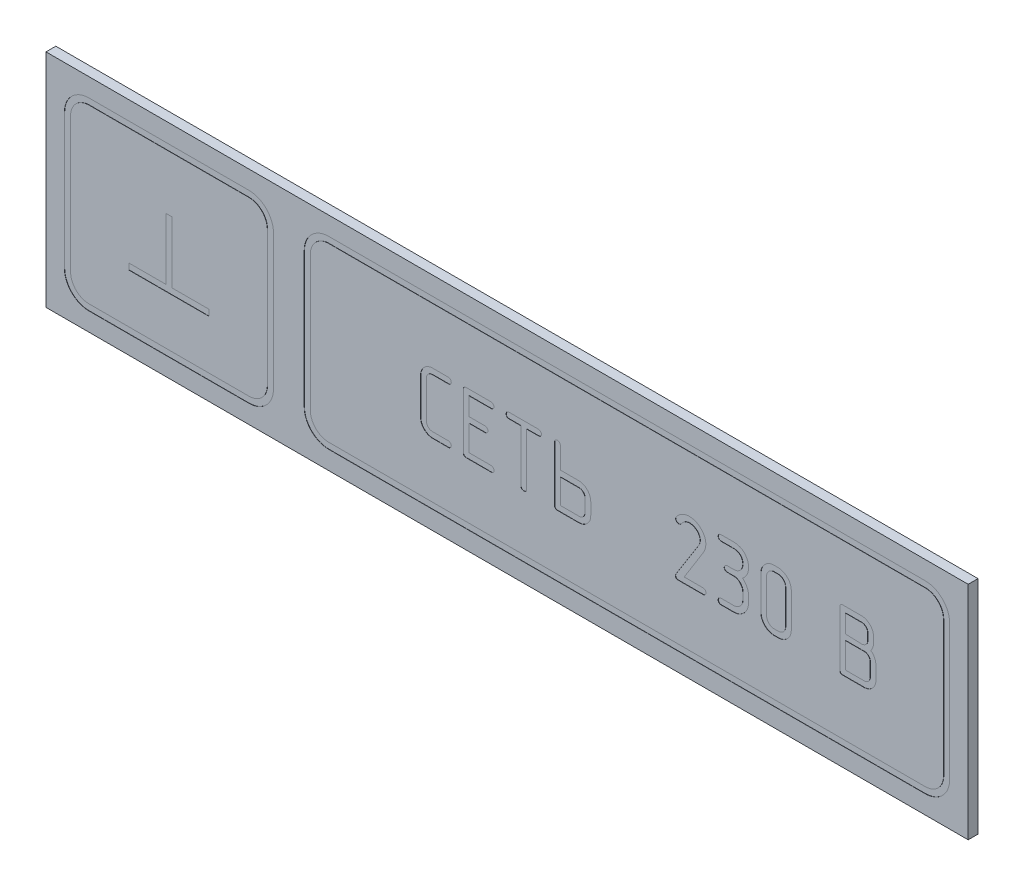
from build123d import *

# Parameters (mm, degrees)
SKETCH_1_W                 = 75
SKETCH_1_H                 = 18
EXTRUDE_1_DEPTH            = 0.8
CUT_EXTRUDE_1_DEPTH        = 0.02
CUT_EXTRUDE_1_2_DEPTH      = 0.02
CUT_EXTRUDE_1_2_DEPTH_BACK = 0.02
SKETCH_3_W                 = 0.5
SKETCH_3_H                 = 5
CUT_EXTRUDE_2_DEPTH        = 0.02
CUT_EXTRUDE_2_DEPTH_BACK   = 0.02
SKETCH_4_W                 = 6.5
SKETCH_4_H                 = 0.5
CUT_EXTRUDE_3_DEPTH        = 0.02
CUT_EXTRUDE_3_DEPTH_BACK   = 0.02
CUT_EXTRUDE_4_DEPTH        = 0.02
CUT_EXTRUDE_4_DEPTH_BACK   = 0.02


with BuildPart() as part:
    # Эскиз1 → Вытянуть1 (new body)
    with BuildSketch(Plane.XY):
        with Locations((37.5, 9)):
            Rectangle(SKETCH_1_W, SKETCH_1_H)
    extrude(amount=EXTRUDE_1_DEPTH)

    # Эскиз2 → Cut-Extrude 1 (cut)
    # profile 1 of 8: a face of its own
    with BuildSketch(Plane.XY.offset(0.8)):
        with BuildLine():
            Line((32.711430426, 6.5), (31.465384009, 6.5))
            add(Edge.make_bspline(
                [(31.465384009, 6.5), (31.431912507, 6.500692398), (31.366073578, 6.502054355), (31.269135798, 6.516147373), (31.176104046, 6.539026677), (31.086487447, 6.571099898), (30.999214891, 6.610006247), (30.916804958, 6.66126394), (30.837218441, 6.71958233), (30.762182539, 6.786197437), (30.694019841, 6.859929755), (30.633066214, 6.937710954), (30.582651343, 7.020395092), (30.540431871, 7.106184125), (30.507819861, 7.196573266), (30.485489392, 7.290884807), (30.469610078, 7.388654905), (30.468489421, 7.455271142), (30.467920197, 7.489108095)],
                knots=[0, 0, 0, 0, 1.028286897, 2.022655204, 3.003804875, 3.968473356, 4.945411562, 5.93469887, 6.945007337, 7.975963957, 9.013399247, 10.028062878, 11.008219808, 11.984630304, 12.962974347, 13.954516674, 14.96102025, 16, 16, 16, 16], degree=3))
            Line((30.467920197, 7.489108095), (30.467920197, 10.457476843))
            add(Edge.make_bspline(
                [(30.467920197, 10.457476843), (30.468608989, 10.491296864), (30.469964025, 10.557829724), (30.484112278, 10.655793657), (30.506806414, 10.750026222), (30.539545402, 10.840157986), (30.580522135, 10.92614383), (30.629595652, 11.008725853), (30.690124145, 11.08571364), (30.757254904, 11.159304164), (30.830738751, 11.227240256), (30.910229977, 11.285561399), (30.993344013, 11.334758989), (31.079606898, 11.376551217), (31.170705417, 11.407165236), (31.265263444, 11.4306427), (31.364007094, 11.444486985), (31.431221697, 11.445877963), (31.465384009, 11.446584938)],
                knots=[0, 0, 0, 0, 1.037183757, 2.040412751, 3.030241086, 4.006893952, 4.976980221, 5.949886173, 6.947810811, 7.976208698, 9.004606584, 10.01316862, 10.99524074, 11.965327009, 12.948502614, 13.93833095, 14.952141686, 16, 16, 16, 16], degree=3))
            Line((31.465384009, 11.446584938), (32.711430426, 11.446584938))
            add(Edge.make_bspline(
                [(32.711430426, 11.446584938), (32.728236112, 11.445906647), (32.761049842, 11.444582258), (32.808190363, 11.430479344), (32.85063334, 11.406583863), (32.888980052, 11.375643018), (32.920420665, 11.33890977), (32.944674489, 11.299360852), (32.958873659, 11.256746607), (32.960328798, 11.227347282), (32.961057495, 11.212624839)],
                knots=[0, 0, 0, 0, 1.064052253, 2.077601868, 3.0860831, 4.13837496, 5.187880517, 6.138828305, 7.06797199, 8, 8, 8, 8], degree=3))
            add(Edge.make_bspline(
                [(32.961057495, 11.212624839), (32.957710349, 11.185576062), (32.950561645, 11.127806356), (32.908493276, 11.064068569), (32.863109533, 11.019749207), (32.818623115, 10.994831447), (32.765769924, 10.981780717), (32.728211501, 10.979744432), (32.708297032, 10.978664741)],
                knots=[0, 0, 0, 0, 1.266254501, 2.704416213, 3.467614585, 4.236046379, 5.064705186, 6, 6, 6, 6], degree=3))
            Line((32.708297032, 10.978664741), (31.442405785, 10.978664741))
            add(Edge.make_bspline(
                [(31.442405785, 10.978664741), (31.408124572, 10.9767522), (31.340969725, 10.973005646), (31.24432295, 10.946654529), (31.156095082, 10.900695466), (31.106349514, 10.857544089), (31.08102099, 10.835573073)],
                knots=[0, 0, 0, 0, 1.032059628, 2.021743112, 2.992747939, 4, 4, 4, 4], degree=3))
            add(Edge.make_bspline(
                [(31.08102099, 10.835573073), (31.058649956, 10.8106462), (31.014364988, 10.761301776), (30.968174097, 10.673004457), (30.941568469, 10.577039088), (30.937769851, 10.510910707), (30.935840394, 10.477321673)],
                knots=[0, 0, 0, 0, 1.010358544, 2.000072701, 2.984163436, 4, 4, 4, 4], degree=3))
            Line((30.935840394, 10.477321673), (30.935840394, 7.469263265))
            add(Edge.make_bspline(
                [(30.935840394, 7.469263265), (30.937619289, 7.435285028), (30.941108852, 7.368631758), (30.969501979, 7.273234658), (31.014426689, 7.18481654), (31.058564491, 7.135899799), (31.08102099, 7.111011864)],
                knots=[0, 0, 0, 0, 1.026550069, 2.013727771, 2.989421339, 4, 4, 4, 4], degree=3))
            add(Edge.make_bspline(
                [(31.08102099, 7.111011864), (31.106546591, 7.0902839), (31.157077608, 7.049250385), (31.214498254, 7.018599617), (31.242913023, 7.003431997)],
                knots=[0, 0, 0, 0, 1.010294363, 2, 2, 2, 2], degree=3))
            add(Edge.make_bspline(
                [(31.242913023, 7.003431997), (31.277490783, 6.993357837), (31.342743748, 6.974346517), (31.410536592, 6.969975158), (31.442405785, 6.967920197)],
                knots=[0, 0, 0, 0, 1.059806561, 2, 2, 2, 2], degree=3))
            Line((31.442405785, 6.967920197), (32.708297032, 6.967920197))
            add(Edge.make_bspline(
                [(32.708297032, 6.967920197), (32.725099979, 6.967215952), (32.758243218, 6.965826854), (32.806027173, 6.951787857), (32.849432241, 6.928244075), (32.887885736, 6.896933272), (32.919486601, 6.860289213), (32.943336648, 6.820479722), (32.959177226, 6.778299232), (32.960431674, 6.74871775), (32.961057495, 6.733960098)],
                knots=[0, 0, 0, 0, 1.057748023, 2.086371758, 3.108174774, 4.154232081, 5.197519594, 6.142833266, 7.073494011, 8, 8, 8, 8], degree=3))
            add(Edge.make_bspline(
                [(32.961057495, 6.733960098), (32.957667706, 6.7069257), (32.950450626, 6.649367712), (32.909356455, 6.585759924), (32.865129234, 6.540784748), (32.820667275, 6.516216561), (32.768211496, 6.503190536), (32.730998743, 6.501099546), (32.711430426, 6.5)],
                knots=[0, 0, 0, 0, 1.274021799, 2.712475087, 3.468462899, 4.24160831, 5.075350171, 6, 6, 6, 6], degree=3))
        make_face()
    # profile 2 of 8: a face of its own
    with BuildSketch(Plane.XY.offset(0.8)):
        with BuildLine():
            Line((34.411818998, 9.508058408), (35.692332751, 9.508058408))
            add(Edge.make_bspline(
                [(35.692332751, 9.508058408), (35.709488684, 9.507384113), (35.742989971, 9.506067383), (35.791091929, 9.491912313), (35.834571553, 9.468434262), (35.872916627, 9.436725712), (35.905677323, 9.400786893), (35.929415327, 9.360577439), (35.945313233, 9.318447448), (35.946560104, 9.288859291), (35.947182144, 9.27409831)],
                knots=[0, 0, 0, 0, 1.074751076, 2.09872259, 3.115904232, 4.15723047, 5.210194549, 6.151232792, 7.077684378, 8, 8, 8, 8], degree=3))
            add(Edge.make_bspline(
                [(35.947182144, 9.27409831), (35.946247595, 9.260459507), (35.944347103, 9.23272373), (35.932807206, 9.191665272), (35.911722217, 9.152225082), (35.88470522, 9.114203049), (35.848604782, 9.080976147), (35.803687653, 9.056293589), (35.750120921, 9.043352744), (35.712239866, 9.041245567), (35.692332751, 9.040138211)],
                knots=[0, 0, 0, 0, 0.847894216, 1.724271911, 2.623827054, 3.614447941, 4.609544371, 5.645179484, 6.762503223, 8, 8, 8, 8], degree=3))
            Line((35.692332751, 9.040138211), (34.411818998, 9.040138211))
            Line((34.411818998, 9.040138211), (34.411818998, 6.967920197))
            Line((34.411818998, 6.967920197), (36.187409031, 6.967920197))
            add(Edge.make_bspline(
                [(36.187409031, 6.967920197), (36.204211978, 6.967215952), (36.237355217, 6.965826854), (36.285139172, 6.951787857), (36.32854424, 6.928244075), (36.366997735, 6.896933272), (36.3985986, 6.860289213), (36.422448647, 6.820479722), (36.438289225, 6.778299232), (36.439543673, 6.74871775), (36.440169494, 6.733960098)],
                knots=[0, 0, 0, 0, 1.057748023, 2.086371758, 3.108174774, 4.154232081, 5.197519594, 6.142833266, 7.073494011, 8, 8, 8, 8], degree=3))
            add(Edge.make_bspline(
                [(36.440169494, 6.733960098), (36.436906743, 6.706205379), (36.430086342, 6.648187368), (36.38871287, 6.584335932), (36.343876302, 6.540831002), (36.299823699, 6.5161683), (36.247310578, 6.503204568), (36.21010629, 6.501104382), (36.190542425, 6.5)],
                knots=[0, 0, 0, 0, 1.304816916, 2.72756791, 3.471350905, 4.243614303, 5.076405022, 6, 6, 6, 6], degree=3))
            Line((36.190542425, 6.5), (34.193525871, 6.5))
            add(Edge.make_bspline(
                [(34.193525871, 6.5), (34.173943068, 6.500307436), (34.136824002, 6.500890179), (34.08552212, 6.512977478), (34.040858207, 6.529891887), (34.005753436, 6.557221721), (33.977559815, 6.590463179), (33.957212412, 6.63152853), (33.946345777, 6.680140438), (33.94474059, 6.714760346), (33.943898802, 6.732915634)],
                knots=[0, 0, 0, 0, 1.198038817, 2.270874244, 3.219060548, 4.103495656, 4.967836238, 5.87544602, 6.885846531, 8, 8, 8, 8], degree=3))
            Line((33.943898802, 6.732915634), (33.943898802, 11.199046798))
            add(Edge.make_bspline(
                [(33.943898802, 11.199046798), (33.944707034, 11.218589728), (33.946224189, 11.255274301), (33.957152046, 11.306679172), (33.977892552, 11.349758643), (34.004943753, 11.386098097), (34.040842169, 11.414423613), (34.085248662, 11.432906871), (34.136901453, 11.444311521), (34.173963095, 11.445799511), (34.193525871, 11.446584938)],
                knots=[0, 0, 0, 0, 1.164715309, 2.18631923, 3.105001799, 3.992953645, 4.864517145, 5.793449026, 6.835284691, 8, 8, 8, 8], degree=3))
            Line((34.193525871, 11.446584938), (36.190542425, 11.446584938))
            add(Edge.make_bspline(
                [(36.190542425, 11.446584938), (36.207348111, 11.445906647), (36.240161841, 11.444582258), (36.287302362, 11.430479344), (36.329745339, 11.406583863), (36.368092051, 11.375643018), (36.399532664, 11.33890977), (36.423786488, 11.299360852), (36.437985657, 11.256746607), (36.439440797, 11.227347282), (36.440169494, 11.212624839)],
                knots=[0, 0, 0, 0, 1.064052253, 2.077601868, 3.0860831, 4.13837496, 5.187880517, 6.138828305, 7.06797199, 8, 8, 8, 8], degree=3))
            add(Edge.make_bspline(
                [(36.440169494, 11.212624839), (36.439234859, 11.198986186), (36.43733419, 11.171250714), (36.425795662, 11.130189893), (36.404705122, 11.090759289), (36.377711065, 11.052697639), (36.341748371, 11.019831212), (36.297812033, 10.994773338), (36.244859099, 10.98179796), (36.207315591, 10.979750407), (36.187409031, 10.978664741)],
                knots=[0, 0, 0, 0, 0.852137248, 1.732900512, 2.636957208, 3.632535361, 4.632611452, 5.654418168, 6.756310542, 8, 8, 8, 8], degree=3))
            Line((36.187409031, 10.978664741), (34.411818998, 10.978664741))
            Line((34.411818998, 10.978664741), (34.411818998, 9.508058408))
        make_face()
    # profile 3 of 8: a face of its own
    with BuildSketch(Plane.XY.offset(0.8)):
        with BuildLine():
            Line((38.62310077, 10.978664741), (37.660104293, 10.978664741))
            add(Edge.make_bspline(
                [(37.660104293, 10.978664741), (37.642618894, 10.979468618), (37.608984886, 10.981014916), (37.560864097, 10.992881229), (37.517093095, 11.012092479), (37.493277493, 11.032356604), (37.481500825, 11.042377089)],
                knots=[0, 0, 0, 0, 1.079416544, 2.076309691, 3.048747018, 4, 4, 4, 4], degree=3))
            add(Edge.make_bspline(
                [(37.481500825, 11.042377089), (37.471950903, 11.055302304), (37.453491957, 11.080285316), (37.434330838, 11.122536854), (37.422446147, 11.166710942), (37.420738623, 11.197231378), (37.419877406, 11.212624839)],
                knots=[0, 0, 0, 0, 1.042916738, 2.015842924, 2.999259183, 4, 4, 4, 4], degree=3))
            add(Edge.make_bspline(
                [(37.419877406, 11.212624839), (37.42294619, 11.239589146), (37.429413653, 11.296416434), (37.468552347, 11.360662601), (37.512728587, 11.403894427), (37.554489546, 11.43070816), (37.605120914, 11.443204007), (37.640562399, 11.445425505), (37.659059828, 11.446584938)],
                knots=[0, 0, 0, 0, 1.300166254, 2.740100978, 3.513473502, 4.283912407, 5.104348798, 6, 6, 6, 6], degree=3))
            Line((37.659059828, 11.446584938), (40.055061907, 11.446584938))
            add(Edge.make_bspline(
                [(40.055061907, 11.446584938), (40.071184668, 11.445924357), (40.102659314, 11.444634779), (40.147927242, 11.430177544), (40.188958848, 11.406842335), (40.225408579, 11.375534279), (40.254767186, 11.33860054), (40.277733872, 11.299100649), (40.292106311, 11.256769586), (40.293530921, 11.22735495), (40.29424433, 11.212624839)],
                knots=[0, 0, 0, 0, 1.043365491, 2.036844728, 3.048657267, 4.090308507, 5.13489674, 6.096248124, 7.046648906, 8, 8, 8, 8], degree=3))
            add(Edge.make_bspline(
                [(40.29424433, 11.212624839), (40.291233495, 11.185601056), (40.284834869, 11.128170112), (40.244469059, 11.064661688), (40.201676978, 11.019825586), (40.15922668, 10.994837625), (40.108727282, 10.981855501), (40.072888082, 10.979765305), (40.054017443, 10.978664741)],
                knots=[0, 0, 0, 0, 1.296042091, 2.754348639, 3.513317893, 4.272657647, 5.090491591, 6, 6, 6, 6], degree=3))
            Line((40.054017443, 10.978664741), (39.091020966, 10.978664741))
            Line((39.091020966, 10.978664741), (39.091020966, 6.748582605))
            add(Edge.make_bspline(
                [(39.091020966, 6.748582605), (39.090284007, 6.730049297), (39.088861021, 6.694263594), (39.076135386, 6.643575312), (39.055199743, 6.598094859), (39.034507943, 6.57307363), (39.024175224, 6.560578954)],
                knots=[0, 0, 0, 0, 1.08722023, 2.099298278, 3.050859919, 4, 4, 4, 4], degree=3))
            add(Edge.make_bspline(
                [(39.024175224, 6.560578954), (39.013018221, 6.551381335), (38.990772775, 6.533042616), (38.950475529, 6.513898163), (38.905390124, 6.502467056), (38.873494061, 6.500838863), (38.857060868, 6.5)],
                knots=[0, 0, 0, 0, 0.951182289, 1.896519658, 2.916264364, 4, 4, 4, 4], degree=3))
            add(Edge.make_bspline(
                [(38.857060868, 6.5), (38.841654791, 6.500796682), (38.811782908, 6.502341423), (38.768716301, 6.514664906), (38.728436038, 6.533450772), (38.691612068, 6.560577211), (38.660895075, 6.596480035), (38.638866714, 6.64055326), (38.624750394, 6.692023793), (38.623672411, 6.728983367), (38.62310077, 6.748582605)],
                knots=[0, 0, 0, 0, 0.960624492, 1.862619603, 2.776848362, 3.724840655, 4.696474829, 5.698056661, 6.779305879, 8, 8, 8, 8], degree=3))
            Line((38.62310077, 6.748582605), (38.62310077, 10.978664741))
        make_face()
    # profile 4 of 8: a face of its own
    with BuildSketch(Plane.XY.offset(0.8)):
        with BuildLine():
            Line((41.831696405, 9.461057495), (41.831696405, 11.198002333))
            add(Edge.make_bspline(
                [(41.831696405, 11.198002333), (41.831002357, 11.2141177), (41.829633073, 11.245911663), (41.815332568, 11.291881459), (41.791771544, 11.334143945), (41.760392799, 11.372338028), (41.724417978, 11.405075695), (41.684217161, 11.428819224), (41.642085019, 11.444715754), (41.612497146, 11.445962806), (41.597736306, 11.446584938)],
                knots=[0, 0, 0, 0, 1.02561598, 2.023434959, 3.037439818, 4.095495264, 5.165375516, 6.12153181, 7.062867111, 8, 8, 8, 8], degree=3))
            add(Edge.make_bspline(
                [(41.597736306, 11.446584938), (41.570746348, 11.443121348), (41.513460757, 11.435769956), (41.449328224, 11.39594937), (41.40456331, 11.351675444), (41.380214425, 11.307531272), (41.366826232, 11.25552033), (41.36483359, 11.218625045), (41.363776208, 11.199046798)],
                knots=[0, 0, 0, 0, 1.279197715, 2.715068902, 3.474128036, 4.250414473, 5.071593634, 6, 6, 6, 6], degree=3))
            Line((41.363776208, 11.199046798), (41.363776208, 6.74753814))
            add(Edge.make_bspline(
                [(41.363776208, 6.74753814), (41.364548248, 6.727978576), (41.365997466, 6.69126278), (41.377340277, 6.640206869), (41.396508716, 6.596572315), (41.423844683, 6.5604979), (41.459444036, 6.532447746), (41.502973654, 6.51361697), (41.553642587, 6.502283306), (41.590012497, 6.500789254), (41.609225418, 6.5)],
                knots=[0, 0, 0, 0, 1.174787525, 2.205226063, 3.123069814, 4.018700482, 4.897801082, 5.815644833, 6.846083372, 8, 8, 8, 8], degree=3))
            Line((41.609225418, 6.5), (43.324236497, 6.5))
            add(Edge.make_bspline(
                [(43.324236497, 6.5), (43.356669048, 6.500680743), (43.420784383, 6.502026491), (43.515138826, 6.516432114), (43.606619104, 6.53797646), (43.694874371, 6.569559126), (43.77959311, 6.610735511), (43.861285416, 6.659709194), (43.93934609, 6.718127268), (44.013441676, 6.784118788), (44.082493205, 6.856470998), (44.141683191, 6.935017182), (44.192648583, 7.016924416), (44.233272361, 7.103352605), (44.266127524, 7.193409251), (44.288790088, 7.287662175), (44.302996441, 7.385966087), (44.304315165, 7.452849702), (44.304988873, 7.487019165)],
                knots=[0, 0, 0, 0, 1.005611403, 1.987975318, 2.954832135, 3.918424373, 4.889616893, 5.873405385, 6.869454867, 7.910141302, 8.94948115, 9.967147977, 10.956555291, 11.937492561, 12.925069879, 13.925970042, 14.940420758, 16, 16, 16, 16], degree=3))
            Line((44.304988873, 7.487019165), (44.304988873, 8.47403833))
            add(Edge.make_bspline(
                [(44.304988873, 8.47403833), (44.304290285, 8.507159438), (44.302916327, 8.572300816), (44.288915532, 8.668239561), (44.265605851, 8.760402271), (44.234718514, 8.849661222), (44.193154696, 8.934599898), (44.144010001, 9.016738928), (44.085021965, 9.095296252), (44.017753197, 9.169597797), (43.944475735, 9.237888845), (43.866777798, 9.298121054), (43.784885101, 9.348658558), (43.698515226, 9.389356746), (43.608442883, 9.422191866), (43.514194133, 9.444859816), (43.416234565, 9.45901513), (43.349701105, 9.460369196), (43.315880779, 9.461057495)],
                knots=[0, 0, 0, 0, 1.022954788, 2.011909854, 2.987787447, 3.957537673, 4.924718387, 5.904443042, 6.911432781, 7.954998824, 8.997899186, 10.002817874, 10.988138141, 11.965023352, 12.948521182, 13.945286823, 14.955547042, 16, 16, 16, 16], degree=3))
            Line((43.315880779, 9.461057495), (41.831696405, 9.461057495))
        make_face()
        with BuildLine():
            Line((41.831696405, 8.968070145), (43.335725609, 8.968070145))
            add(Edge.make_bspline(
                [(43.335725609, 8.968070145), (43.369721355, 8.966783325), (43.436102874, 8.964270627), (43.530847687, 8.935091517), (43.618137985, 8.891455637), (43.693942241, 8.828911787), (43.7581623, 8.754758212), (43.803954641, 8.667566665), (43.831903166, 8.570785518), (43.835313255, 8.502779297), (43.837068677, 8.467771542)],
                knots=[0, 0, 0, 0, 1.028363177, 2.008025063, 2.981456648, 3.973180373, 4.970236738, 5.939185353, 6.939148595, 8, 8, 8, 8], degree=3))
            Line((43.837068677, 8.467771542), (43.837068677, 7.4682188))
            add(Edge.make_bspline(
                [(43.837068677, 7.4682188), (43.835212322, 7.434265452), (43.831594359, 7.368091702), (43.80456291, 7.272737522), (43.75940863, 7.185158344), (43.715993813, 7.135961093), (43.693977009, 7.111011864)],
                knots=[0, 0, 0, 0, 1.031628677, 2.010603999, 2.991124575, 4, 4, 4, 4], degree=3))
            add(Edge.make_bspline(
                [(43.693977009, 7.111011864), (43.669048095, 7.088957816), (43.61965886, 7.045264275), (43.531136913, 7.000450543), (43.435472719, 6.973585986), (43.369324646, 6.969828674), (43.335725609, 6.967920197)],
                knots=[0, 0, 0, 0, 1.00659897, 1.994276692, 2.98121943, 4, 4, 4, 4], degree=3))
            Line((43.335725609, 6.967920197), (41.831696405, 6.967920197))
            Line((41.831696405, 6.967920197), (41.831696405, 8.968070145))
        make_face(mode=Mode.SUBTRACT)
    # profile 5 of 8: a face of its own
    with BuildSketch(Plane.XY.offset(0.8)):
        with BuildLine():
            Line((53.504634171, 9.531036632), (51.906603142, 6.967920197))
            Line((51.906603142, 6.967920197), (53.436743964, 6.967920197))
            add(Edge.make_bspline(
                [(53.436743964, 6.967920197), (53.453200238, 6.967215935), (53.485662872, 6.965826665), (53.532433589, 6.951777317), (53.574763362, 6.9281924), (53.612293765, 6.896937562), (53.64256076, 6.8599309), (53.666894268, 6.820726502), (53.681043954, 6.778074315), (53.682505656, 6.748680022), (53.683237639, 6.733960098)],
                knots=[0, 0, 0, 0, 1.049035914, 2.069391155, 3.084643979, 4.126821057, 5.168998136, 6.1263312, 7.061713754, 8, 8, 8, 8], degree=3))
            add(Edge.make_bspline(
                [(53.683237639, 6.733960098), (53.67977405, 6.706970154), (53.672422658, 6.649684593), (53.63260207, 6.585551853), (53.588328148, 6.540787406), (53.544183963, 6.516437002), (53.492511727, 6.503142252), (53.455971209, 6.501083365), (53.436743964, 6.5)],
                knots=[0, 0, 0, 0, 1.282713716, 2.722531535, 3.483677017, 4.262097154, 5.085533406, 6, 6, 6, 6], degree=3))
            Line((53.436743964, 6.5), (51.462705634, 6.5))
            add(Edge.make_bspline(
                [(51.462705634, 6.5), (51.441771482, 6.500501492), (51.402447635, 6.501443522), (51.347268985, 6.51094531), (51.299927755, 6.525849026), (51.260855138, 6.548151232), (51.230874955, 6.576988932), (51.208838341, 6.611935856), (51.196373952, 6.653766875), (51.195000075, 6.683742613), (51.194278199, 6.699492762)],
                knots=[0, 0, 0, 0, 1.318247643, 2.476267915, 3.517133912, 4.431675526, 5.285213851, 6.113267656, 7.008654443, 8, 8, 8, 8], degree=3))
            add(Edge.make_bspline(
                [(51.194278199, 6.699492762), (51.195225585, 6.713142022), (51.197222141, 6.741906965), (51.209891279, 6.786353273), (51.228759325, 6.83462218), (51.245806811, 6.867113629), (51.254857154, 6.884363019)],
                knots=[0, 0, 0, 0, 0.834498753, 1.75865294, 2.810090946, 4, 4, 4, 4], degree=3))
            Line((51.254857154, 6.884363019), (53.102515252, 9.813042108))
            add(Edge.make_bspline(
                [(53.102515252, 9.813042108), (53.116782622, 9.844801891), (53.144644197, 9.906822961), (53.17377545, 10.001784775), (53.19117696, 10.094761627), (53.194058411, 10.155906435), (53.195472613, 10.185916014)],
                knots=[0, 0, 0, 0, 1.077976984, 2.105092662, 3.069988531, 4, 4, 4, 4], degree=3))
            add(Edge.make_bspline(
                [(53.195472613, 10.185916014), (53.194577662, 10.2120619), (53.192803042, 10.263907219), (53.181434587, 10.340401349), (53.160987675, 10.414035766), (53.134229733, 10.485481122), (53.098175102, 10.553457344), (53.05492101, 10.618956462), (53.003543243, 10.681689307), (52.964640714, 10.720654957), (52.944801079, 10.740526783)],
                knots=[0, 0, 0, 0, 1.001356293, 1.985614019, 2.952654674, 3.923273066, 4.901280323, 5.892287325, 6.925101988, 8, 8, 8, 8], degree=3))
            add(Edge.make_bspline(
                [(52.944801079, 10.740526783), (52.903515721, 10.774973534), (52.819790637, 10.844830192), (52.695681836, 10.906168747), (52.589785564, 10.943383599), (52.506365481, 10.964726399), (52.419400822, 10.976049041), (52.360627212, 10.977781354), (52.33065582, 10.978664741)],
                knots=[0, 0, 0, 0, 1.432193878, 2.904432902, 3.663213759, 4.430043462, 5.199406286, 6, 6, 6, 6], degree=3))
            add(Edge.make_bspline(
                [(52.33065582, 10.978664741), (52.299213528, 10.977505074), (52.236460616, 10.975190597), (52.144018371, 10.955006443), (52.052487553, 10.925364638), (51.995336955, 10.89496986), (51.966137631, 10.879440592)],
                knots=[0, 0, 0, 0, 0.986895246, 1.969657644, 2.962659636, 4, 4, 4, 4], degree=3))
            add(Edge.make_bspline(
                [(51.966137631, 10.879440592), (51.937789984, 10.860593465), (51.881260157, 10.823009225), (51.805439643, 10.755109082), (51.735132637, 10.681291649), (51.696328942, 10.625489101), (51.676820902, 10.597435116)],
                knots=[0, 0, 0, 0, 1.002390868, 1.998930695, 2.993989149, 4, 4, 4, 4], degree=3))
            add(Edge.make_bspline(
                [(51.676820902, 10.597435116), (51.664625878, 10.581721562), (51.637510538, 10.546782857), (51.600210284, 10.522862399), (51.579685683, 10.509700079)],
                knots=[0, 0, 0, 0, 0.899492679, 2, 2, 2, 2], degree=3))
            Line((51.579685683, 10.509700079), (51.468972422, 10.484632926))
            add(Edge.make_bspline(
                [(51.468972422, 10.484632926), (51.453178033, 10.485292438), (51.4216785, 10.486607737), (51.376220996, 10.501866226), (51.331574372, 10.52195485), (51.291727721, 10.552858747), (51.256074234, 10.588039409), (51.230256737, 10.629870063), (51.215090885, 10.676146124), (51.213067927, 10.708384477), (51.2120341, 10.724859813)],
                knots=[0, 0, 0, 0, 0.970789839, 1.936094272, 2.935708313, 3.980052531, 5.028588703, 6.012606459, 6.984347121, 8, 8, 8, 8], degree=3))
            add(Edge.make_bspline(
                [(51.2120341, 10.724859813), (51.214707654, 10.744933474), (51.221258889, 10.794121649), (51.242364644, 10.839187841), (51.254857154, 10.86586255)],
                knots=[0, 0, 0, 0, 0.816198688, 2, 2, 2, 2], degree=3))
            add(Edge.make_bspline(
                [(51.254857154, 10.86586255), (51.284430334, 10.907468809), (51.34385958, 10.991079316), (51.453080612, 11.101386744), (51.575597773, 11.2011203), (51.667004178, 11.255178672), (51.713377168, 11.282603976)],
                knots=[0, 0, 0, 0, 0.97790503, 1.965164305, 2.967671729, 4, 4, 4, 4], degree=3))
            add(Edge.make_bspline(
                [(51.713377168, 11.282603976), (51.76021365, 11.306778213), (51.852421847, 11.35437066), (51.996996822, 11.403980325), (52.139789214, 11.44088646), (52.235737645, 11.444714742), (52.282610443, 11.446584938)],
                knots=[0, 0, 0, 0, 1.055887345, 2.078752778, 3.061430904, 4, 4, 4, 4], degree=3))
            add(Edge.make_bspline(
                [(52.282610443, 11.446584938), (52.330013676, 11.445339105), (52.423070205, 11.442893432), (52.560219668, 11.424801572), (52.691640072, 11.394509317), (52.817871348, 11.352910314), (52.937849301, 11.298021536), (53.051951821, 11.230704391), (53.160968106, 11.151956948), (53.26349541, 11.062919145), (53.356973433, 10.965476058), (53.439099555, 10.861738506), (53.507821432, 10.752936801), (53.565524743, 10.640006453), (53.608891862, 10.522031502), (53.640626607, 10.399638947), (53.659923683, 10.272525261), (53.662224669, 10.18598323), (53.663392809, 10.142048496)],
                knots=[0, 0, 0, 0, 1.07713943, 2.114515162, 3.137548884, 4.138402978, 5.129829663, 6.129964134, 7.144517493, 8.182134601, 9.211847614, 10.209098401, 11.183711391, 12.132050352, 13.08591865, 14.033960487, 15.001902051, 16, 16, 16, 16], degree=3))
            add(Edge.make_bspline(
                [(53.663392809, 10.142048496), (53.661733924, 10.091054909), (53.658375823, 9.987828042), (53.625762111, 9.834173184), (53.577595714, 9.679588014), (53.529326711, 9.581311212), (53.504634171, 9.531036632)],
                knots=[0, 0, 0, 0, 0.958992559, 1.941298943, 2.946848803, 4, 4, 4, 4], degree=3))
        make_face()
    # profile 6 of 8: a face of its own
    with BuildSketch(Plane.XY.offset(0.8)):
        with BuildLine():
            Line((55.933014657, 10.978664741), (54.919883874, 10.978664741))
            add(Edge.make_bspline(
                [(54.919883874, 10.978664741), (54.901353526, 10.979405713), (54.865573537, 10.980836447), (54.814845452, 10.993508115), (54.769250102, 11.014752761), (54.743702589, 11.035208227), (54.730835758, 11.045510483)],
                knots=[0, 0, 0, 0, 1.082783474, 2.090731409, 3.038409894, 4, 4, 4, 4], degree=3))
            add(Edge.make_bspline(
                [(54.730835758, 11.045510483), (54.72083966, 11.057307845), (54.701033357, 11.080683176), (54.682008503, 11.122259595), (54.668118064, 11.166128906), (54.666771203, 11.196839991), (54.666078945, 11.212624839)],
                knots=[0, 0, 0, 0, 1.007594706, 1.996451512, 2.970218466, 4, 4, 4, 4], degree=3))
            add(Edge.make_bspline(
                [(54.666078945, 11.212624839), (54.666824707, 11.226667566), (54.668309741, 11.254630831), (54.682361834, 11.295313358), (54.701789194, 11.335310406), (54.730412756, 11.372862373), (54.765614224, 11.406226992), (54.809643684, 11.429693181), (54.859324785, 11.44504398), (54.895040843, 11.446057695), (54.913617085, 11.446584938)],
                knots=[0, 0, 0, 0, 0.886426588, 1.765140182, 2.701969987, 3.694250836, 4.73997423, 5.746606742, 6.827989987, 8, 8, 8, 8], degree=3))
            Line((54.913617085, 11.446584938), (55.90272518, 11.446584938))
            add(Edge.make_bspline(
                [(55.90272518, 11.446584938), (55.949763323, 11.445211397), (56.04204877, 11.442516609), (56.176934411, 11.426428622), (56.303948734, 11.396415235), (56.424219488, 11.357418311), (56.536610265, 11.304247972), (56.642355331, 11.240789497), (56.740671096, 11.165146143), (56.798815194, 11.106435637), (56.828120926, 11.076844425)],
                knots=[0, 0, 0, 0, 1.10007907, 2.158275827, 3.169329497, 4.147569055, 5.10903335, 6.069566678, 7.027024855, 8, 8, 8, 8], degree=3))
            add(Edge.make_bspline(
                [(56.828120926, 11.076844425), (56.853146835, 11.047753265), (56.902567364, 10.990304781), (56.964785018, 10.895955579), (57.020176427, 10.798938591), (57.063639049, 10.69642432), (57.097459803, 10.589732246), (57.121297588, 10.47851669), (57.136199839, 10.362832267), (57.13830729, 10.284140309), (57.139371414, 10.244406039)],
                knots=[0, 0, 0, 0, 1.011347742, 1.997183856, 2.975805811, 3.955074047, 4.928163601, 5.924384392, 6.951950476, 8, 8, 8, 8], degree=3))
            add(Edge.make_bspline(
                [(57.139371414, 10.244406039), (57.138183488, 10.196244255), (57.13585357, 10.101782969), (57.110967896, 9.963401947), (57.075831937, 9.830321339), (57.022107181, 9.703952513), (56.95570672, 9.582993524), (56.871468852, 9.469581486), (56.773396491, 9.361032146), (56.69764935, 9.296599793), (56.658917641, 9.263653662)],
                knots=[0, 0, 0, 0, 1.020209835, 2.000970977, 2.973611179, 3.933444388, 4.905159373, 5.893119876, 6.922691094, 8, 8, 8, 8], degree=3))
            add(Edge.make_bspline(
                [(56.658917641, 9.263653662), (56.692394152, 9.234834385), (56.760311872, 9.176365343), (56.849414504, 9.073032087), (56.930265218, 8.957927151), (57.002825413, 8.832901684), (57.06380753, 8.699438833), (57.106559645, 8.558943409), (57.133697791, 8.41380394), (57.137466751, 8.3150508), (57.139371414, 8.265145385)],
                knots=[0, 0, 0, 0, 0.926315811, 1.879325348, 2.854774747, 3.876528351, 4.910341529, 5.927614713, 6.952709267, 8, 8, 8, 8], degree=3))
            Line((57.139371414, 8.265145385), (57.139371414, 7.760668923))
            add(Edge.make_bspline(
                [(57.139371414, 7.760668923), (57.1385947, 7.718467654), (57.137059709, 7.635066861), (57.11800044, 7.512477202), (57.090533984, 7.394012221), (57.05028106, 7.280338972), (56.998870321, 7.17115245), (56.935710494, 7.066326384), (56.861520168, 6.965666647), (56.775873129, 6.871951712), (56.684573181, 6.784134892), (56.585287376, 6.709165249), (56.483257848, 6.643516661), (56.375787454, 6.591240538), (56.264230334, 6.550063044), (56.148048779, 6.520680281), (56.026803062, 6.504001881), (55.944553551, 6.501349089), (55.90272518, 6.5)],
                knots=[0, 0, 0, 0, 1.032030617, 2.03956357, 3.029646226, 4.005320733, 4.985043468, 5.978859951, 6.99639837, 8.040288379, 9.083203961, 10.092249456, 11.080496654, 12.04854917, 13.011071955, 13.986634805, 14.976093788, 16, 16, 16, 16], degree=3))
            Line((55.90272518, 6.5), (54.913617085, 6.5))
            add(Edge.make_bspline(
                [(54.913617085, 6.5), (54.89580324, 6.500860871), (54.861180709, 6.502534037), (54.811777661, 6.513732423), (54.767189446, 6.53398967), (54.742313428, 6.553760216), (54.729791294, 6.563712348)],
                knots=[0, 0, 0, 0, 1.074611043, 2.088586395, 3.037829185, 4, 4, 4, 4], degree=3))
            add(Edge.make_bspline(
                [(54.729791294, 6.563712348), (54.719929359, 6.576639171), (54.700889552, 6.601596164), (54.680318798, 6.64361665), (54.668712155, 6.688074392), (54.666961776, 6.718576088), (54.666078945, 6.733960098)],
                knots=[0, 0, 0, 0, 1.049924066, 2.027021419, 3.004897233, 4, 4, 4, 4], degree=3))
            add(Edge.make_bspline(
                [(54.666078945, 6.733960098), (54.66944874, 6.7609828), (54.676586016, 6.818217296), (54.71778028, 6.882007218), (54.763287144, 6.925616254), (54.807125552, 6.952008345), (54.86003271, 6.96462925), (54.897203978, 6.966786046), (54.916750479, 6.967920197)],
                knots=[0, 0, 0, 0, 1.272750596, 2.69570531, 3.462819016, 4.243362811, 5.076272775, 6, 6, 6, 6], degree=3))
            Line((54.916750479, 6.967920197), (55.919436615, 6.967920197))
            add(Edge.make_bspline(
                [(55.919436615, 6.967920197), (55.944904529, 6.968325527), (55.995416983, 6.969129449), (56.069107506, 6.981457428), (56.140317338, 6.998898881), (56.20815846, 7.024693584), (56.274584255, 7.055060333), (56.33610247, 7.096163553), (56.396187923, 7.141766148), (56.47030305, 7.212370912), (56.550397972, 7.311542221), (56.620487113, 7.445600323), (56.664441666, 7.591530017), (56.669083626, 7.693164282), (56.671451217, 7.745001952)],
                knots=[0, 0, 0, 0, 0.762142209, 1.511614757, 2.232672098, 2.955462843, 3.683354291, 4.415419634, 5.166560015, 5.941375375, 7.477641641, 8.961410111, 10.450193738, 12, 12, 12, 12], degree=3))
            Line((56.671451217, 7.745001952), (56.671451217, 8.263056456))
            add(Edge.make_bspline(
                [(56.671451217, 8.263056456), (56.668923041, 8.314499225), (56.663954587, 8.415596238), (56.622134488, 8.561418302), (56.550963646, 8.694272837), (56.471933105, 8.793765754), (56.39861569, 8.86480434), (56.339034848, 8.911588837), (56.276504378, 8.951351975), (56.210311576, 8.983890857), (56.140983143, 9.009229998), (56.068380011, 9.026478369), (55.992979403, 9.03900032), (55.941424125, 9.03975513), (55.915258756, 9.040138211)],
                knots=[0, 0, 0, 0, 1.533728977, 3.01413434, 4.483223777, 6.007344777, 6.786470932, 7.526637132, 8.264757458, 8.994488945, 9.724368435, 10.46292764, 11.219904006, 12, 12, 12, 12], degree=3))
            Line((55.915258756, 9.040138211), (55.410782294, 9.040138211))
            add(Edge.make_bspline(
                [(55.410782294, 9.040138211), (55.392618424, 9.040995429), (55.357303934, 9.042662045), (55.306921368, 9.053917965), (55.26142295, 9.073829579), (55.236329649, 9.093864916), (55.223823109, 9.103850559)],
                knots=[0, 0, 0, 0, 1.079228925, 2.098254295, 3.052166909, 4, 4, 4, 4], degree=3))
            add(Edge.make_bspline(
                [(55.223823109, 9.103850559), (55.213928831, 9.116768505), (55.194826579, 9.141708359), (55.174659564, 9.183934004), (55.161375105, 9.228029886), (55.159838818, 9.258683929), (55.159066296, 9.27409831)],
                knots=[0, 0, 0, 0, 1.048365217, 2.024011849, 3.006374687, 4, 4, 4, 4], degree=3))
            add(Edge.make_bspline(
                [(55.159066296, 9.27409831), (55.162356969, 9.301179275), (55.169348916, 9.358720278), (55.211907829, 9.421783516), (55.257574896, 9.466464959), (55.302880585, 9.491601342), (55.356766809, 9.505061133), (55.394689552, 9.507014361), (55.414960153, 9.508058408)],
                knots=[0, 0, 0, 0, 1.258100478, 2.673182502, 3.431466272, 4.231225732, 5.054548406, 6, 6, 6, 6], degree=3))
            Line((55.414960153, 9.508058408), (55.925703404, 9.508058408))
            add(Edge.make_bspline(
                [(55.925703404, 9.508058408), (55.953576118, 9.509035076), (56.008122821, 9.510946408), (56.088150721, 9.520804379), (56.163691022, 9.540552194), (56.236394804, 9.564785785), (56.304689473, 9.599026848), (56.369194968, 9.639825328), (56.431058937, 9.686756009), (56.467195189, 9.724105747), (56.485536496, 9.743062971)],
                knots=[0, 0, 0, 0, 1.070147729, 2.094271507, 3.085807588, 4.061830826, 5.029773958, 6.008354147, 6.989120704, 8, 8, 8, 8], degree=3))
            add(Edge.make_bspline(
                [(56.485536496, 9.743062971), (56.514225873, 9.779323388), (56.571214993, 9.851351766), (56.629715251, 9.977534109), (56.665368126, 10.114660039), (56.669387878, 10.210059825), (56.671451217, 10.259028545)],
                knots=[0, 0, 0, 0, 0.987024596, 1.960644339, 2.953198527, 4, 4, 4, 4], degree=3))
            add(Edge.make_bspline(
                [(56.671451217, 10.259028545), (56.669195519, 10.306908635), (56.664826157, 10.399653945), (56.632423954, 10.532695036), (56.575342217, 10.65246793), (56.521046895, 10.72022002), (56.493892214, 10.754104825)],
                knots=[0, 0, 0, 0, 1.067567691, 2.067913768, 3.033707067, 4, 4, 4, 4], degree=3))
            add(Edge.make_bspline(
                [(56.493892214, 10.754104825), (56.476481138, 10.771880085), (56.441899577, 10.807184982), (56.38402489, 10.853522863), (56.320904284, 10.892496411), (56.252280268, 10.923688131), (56.179254834, 10.948890665), (56.101177877, 10.966582565), (56.018609286, 10.97717849), (55.961943721, 10.978162421), (55.933014657, 10.978664741)],
                knots=[0, 0, 0, 0, 0.95779418, 1.902353299, 2.8476737, 3.807718427, 4.800094425, 5.818320437, 6.886202787, 8, 8, 8, 8], degree=3))
        make_face()
    # profile 7 of 8: a face of its own
    with BuildSketch(Plane.XY.offset(0.8)):
        with BuildLine():
            add(Edge.make_bspline(
                [(60.615350019, 7.588332243), (60.614284167, 7.552078162), (60.612184658, 7.480665029), (60.597378262, 7.375254378), (60.57200063, 7.273588493), (60.537581521, 7.175240329), (60.493639894, 7.080480193), (60.438604365, 6.99007284), (60.3736894, 6.903541529), (60.300164142, 6.821494529), (60.21912548, 6.747000167), (60.133573212, 6.680577996), (60.042952564, 6.625154431), (59.948528212, 6.578398188), (59.849202175, 6.543241498), (59.745681884, 6.517773074), (59.637799837, 6.503196466), (59.564312993, 6.501076103), (59.527017775, 6.5)],
                knots=[0, 0, 0, 0, 1.017110807, 2.003500465, 2.9796304, 3.952823126, 4.923020576, 5.904755596, 6.916787402, 7.954379473, 8.991327563, 10.001471775, 10.98829668, 11.96691631, 12.95258013, 13.938195541, 14.953616171, 16, 16, 16, 16], degree=3))
            Line((59.527017775, 6.5), (59.230389794, 6.5))
            add(Edge.make_bspline(
                [(59.230389794, 6.5), (59.19412916, 6.501036513), (59.122703121, 6.503078231), (59.017467996, 6.518294825), (58.915528155, 6.542067986), (58.817004365, 6.576506053), (58.723086846, 6.622058614), (58.632132998, 6.675569281), (58.545262936, 6.739510042), (58.463967821, 6.813142924), (58.388689272, 6.893099271), (58.322728093, 6.978711484), (58.266886712, 7.069448419), (58.22074559, 7.164523284), (58.185064624, 7.26433812), (58.159989923, 7.368317984), (58.14517461, 7.4768432), (58.143110098, 7.550685384), (58.14205755, 7.588332243)],
                knots=[0, 0, 0, 0, 1.016353976, 2.002009663, 2.97511491, 3.947583485, 4.921227131, 5.897216674, 6.902684111, 7.939504111, 8.968529229, 9.977921794, 10.964012404, 11.950682612, 12.935613, 13.92997891, 14.944643966, 16, 16, 16, 16], degree=3))
            Line((58.14205755, 7.588332243), (58.14205755, 10.358252694))
            add(Edge.make_bspline(
                [(58.14205755, 10.358252694), (58.143155717, 10.393807848), (58.145339715, 10.464518732), (58.159927771, 10.568916776), (58.185260081, 10.669578259), (58.220051071, 10.766929794), (58.265009574, 10.86061605), (58.319738396, 10.951355284), (58.385078327, 11.037905427), (58.458260393, 11.120865374), (58.539367138, 11.196805723), (58.625838985, 11.263473686), (58.716199306, 11.320613384), (58.810766309, 11.36676791), (58.909795208, 11.402823964), (59.01328775, 11.42710874), (59.120533418, 11.443802897), (59.193420202, 11.445648707), (59.230389794, 11.446584938)],
                knots=[0, 0, 0, 0, 0.999358025, 1.987489389, 2.955846337, 3.912312608, 4.88840176, 5.871870267, 6.885689055, 7.932412047, 8.97785341, 10.003504867, 10.997241324, 11.97758894, 12.955785167, 13.952648631, 14.961543641, 16, 16, 16, 16], degree=3))
            Line((59.230389794, 11.446584938), (59.527017775, 11.446584938))
            add(Edge.make_bspline(
                [(59.527017775, 11.446584938), (59.563271395, 11.445518089), (59.634683618, 11.443416614), (59.740100917, 11.428624563), (59.841741977, 11.40319337), (59.939884187, 11.369076892), (60.034033628, 11.324574537), (60.124236994, 11.269865209), (60.210813141, 11.204964262), (60.292780983, 11.131048364), (60.368389073, 11.050724943), (60.434754572, 10.964772514), (60.490090845, 10.874160691), (60.537333752, 10.78000828), (60.57042457, 10.68003671), (60.598024559, 10.577124893), (60.612033377, 10.469002229), (60.614233458, 10.395536961), (60.615350019, 10.358252694)],
                knots=[0, 0, 0, 0, 1.01730614, 2.00388523, 2.980202626, 3.953582251, 4.915121034, 5.897044593, 6.909270755, 7.947062092, 8.990861153, 10.001199361, 10.988213781, 11.967021352, 12.949625216, 13.93779958, 14.953415217, 16, 16, 16, 16], degree=3))
            Line((60.615350019, 10.358252694), (60.615350019, 7.588332243))
        make_face()
        with BuildLine():
            Line((60.147429822, 7.569531878), (60.147429822, 10.377053059))
            add(Edge.make_bspline(
                [(60.147429822, 10.377053059), (60.145103493, 10.416938734), (60.140533901, 10.495285907), (60.107719626, 10.608907242), (60.048987681, 10.711450952), (59.972461247, 10.80406345), (59.878783312, 10.880895185), (59.773312526, 10.9389267), (59.655688187, 10.972080395), (59.574223364, 10.976425481), (59.532240099, 10.978664741)],
                knots=[0, 0, 0, 0, 1.000559683, 1.965392911, 2.935275591, 3.94645803, 4.964373359, 5.957237345, 6.947253024, 8, 8, 8, 8], degree=3))
            Line((59.532240099, 10.978664741), (59.22516747, 10.978664741))
            add(Edge.make_bspline(
                [(59.22516747, 10.978664741), (59.184158453, 10.976987015), (59.103811681, 10.973699937), (58.98881889, 10.937853043), (58.881906202, 10.883378328), (58.788791096, 10.805623958), (58.708517595, 10.715141657), (58.651455113, 10.61086846), (58.616248701, 10.496962798), (58.612103305, 10.417696819), (58.609977747, 10.377053059)],
                knots=[0, 0, 0, 0, 1.026138229, 2.01045768, 2.995397565, 4.020344428, 5.036424252, 6.01420537, 6.981780545, 8, 8, 8, 8], degree=3))
            Line((58.609977747, 10.377053059), (58.609977747, 7.569531878))
            add(Edge.make_bspline(
                [(58.609977747, 7.569531878), (58.61214815, 7.529587489), (58.616416856, 7.451025634), (58.651576666, 7.338024259), (58.707693164, 7.233564347), (58.786288877, 7.141600328), (58.880232806, 7.064686216), (58.986481614, 7.007862426), (59.103097233, 6.974637138), (59.18387472, 6.970192339), (59.22516747, 6.967920197)],
                knots=[0, 0, 0, 0, 1.000960555, 1.96866991, 2.94239886, 3.959596256, 4.984685255, 5.973824236, 6.964236563, 8, 8, 8, 8], degree=3))
            Line((59.22516747, 6.967920197), (59.532240099, 6.967920197))
            add(Edge.make_bspline(
                [(59.532240099, 6.967920197), (59.572881691, 6.96968237), (59.652409063, 6.973130588), (59.766737156, 7.007759918), (59.873009777, 7.06114567), (59.967105748, 7.13704155), (60.047893319, 7.226982247), (60.105066609, 7.332291818), (60.141419956, 7.447400169), (60.145394577, 7.528171896), (60.147429822, 7.569531878)],
                knots=[0, 0, 0, 0, 1.016426788, 1.988941573, 2.96891168, 3.981921139, 5.002724824, 5.979540199, 6.96540305, 8, 8, 8, 8], degree=3))
        make_face(mode=Mode.SUBTRACT)
    # profile 8 of 8: a face of its own
    with BuildSketch(Plane.XY.offset(0.8)):
        with BuildLine():
            add(Edge.make_bspline(
                [(67.074319878, 9.372277994), (67.108208395, 9.349637007), (67.175737478, 9.304520692), (67.262489332, 9.218378569), (67.33702137, 9.120209285), (67.394970604, 9.009243158), (67.442286857, 8.89169768), (67.475207497, 8.768549273), (67.497485494, 8.641961107), (67.499465468, 8.555950699), (67.500461486, 8.512683525)],
                knots=[0, 0, 0, 0, 0.974313857, 1.941498973, 2.912237091, 3.915945845, 4.93030387, 5.941881181, 6.964671993, 8, 8, 8, 8], degree=3))
            Line((67.500461486, 8.512683525), (67.500461486, 7.506863995))
            add(Edge.make_bspline(
                [(67.500461486, 7.506863995), (67.499743672, 7.473049161), (67.498324221, 7.406181513), (67.484483074, 7.307804875), (67.461173831, 7.213168197), (67.429885957, 7.122199409), (67.390092405, 7.034287674), (67.339588774, 6.951083047), (67.28054388, 6.871306103), (67.214266428, 6.79539417), (67.141334642, 6.726244399), (67.063133706, 6.666501811), (66.982556062, 6.614501179), (66.897374658, 6.572607215), (66.808097949, 6.539878177), (66.714803619, 6.517576281), (66.618424999, 6.501741612), (66.552849676, 6.500584688), (66.519709109, 6.5)],
                knots=[0, 0, 0, 0, 1.038553944, 2.05370399, 3.044839953, 4.029314396, 5.005852223, 6.003891933, 7.013786344, 8.052340288, 9.096663258, 10.095906219, 11.072268247, 12.038675251, 13.006561345, 13.987308911, 14.982822805, 16, 16, 16, 16], degree=3))
            Line((66.519709109, 6.5), (64.804698031, 6.5))
            add(Edge.make_bspline(
                [(64.804698031, 6.5), (64.785485109, 6.500789254), (64.749115199, 6.502283306), (64.698446267, 6.51361697), (64.654916648, 6.532447746), (64.619317295, 6.5604979), (64.591981328, 6.596572315), (64.57281289, 6.640206869), (64.561470078, 6.69126278), (64.56002086, 6.727978576), (64.55924882, 6.74753814)],
                knots=[0, 0, 0, 0, 1.153916628, 2.184355167, 3.102198918, 3.981299518, 4.876930186, 5.794773937, 6.825212475, 8, 8, 8, 8], degree=3))
            Line((64.55924882, 6.74753814), (64.55924882, 11.199046798))
            add(Edge.make_bspline(
                [(64.55924882, 11.199046798), (64.560057053, 11.218589728), (64.561574207, 11.255274301), (64.572502065, 11.306679172), (64.593242571, 11.349758643), (64.620293772, 11.386098097), (64.656192187, 11.414423613), (64.70059868, 11.432906871), (64.752251472, 11.444311521), (64.789313114, 11.445799511), (64.80887589, 11.446584938)],
                knots=[0, 0, 0, 0, 1.164715309, 2.18631923, 3.105001799, 3.992953645, 4.864517145, 5.793449026, 6.835284691, 8, 8, 8, 8], degree=3))
            Line((64.80887589, 11.446584938), (66.303504911, 11.446584938))
            add(Edge.make_bspline(
                [(66.303504911, 11.446584938), (66.337675675, 11.445912036), (66.404906907, 11.444588097), (66.503449666, 11.430269017), (66.598374591, 11.408608849), (66.68901483, 11.377308868), (66.775511094, 11.336925179), (66.858498759, 11.289016065), (66.937203627, 11.231135095), (67.010236139, 11.164596974), (67.07799448, 11.092985891), (67.138313766, 11.017130087), (67.186740972, 10.935473951), (67.229660882, 10.852486167), (67.260654586, 10.764427215), (67.283963133, 10.673293032), (67.297784769, 10.578014277), (67.299205593, 10.513225724), (67.299924259, 10.480455067)],
                knots=[0, 0, 0, 0, 1.061147515, 2.087815652, 3.08768346, 4.083327943, 5.061119066, 6.050158087, 7.05638581, 8.090551292, 9.116135753, 10.118166958, 11.094160779, 12.061844017, 13.01668066, 13.987564058, 14.982091062, 16, 16, 16, 16], degree=3))
            Line((67.299924259, 10.480455067), (67.299924259, 9.996867899))
            add(Edge.make_bspline(
                [(67.299924259, 9.996867899), (67.297248649, 9.942318707), (67.291895083, 9.833172484), (67.257319275, 9.699899496), (67.217606182, 9.596772774), (67.177790691, 9.520493674), (67.130433977, 9.444908139), (67.093188976, 9.396700828), (67.074319878, 9.372277994)],
                knots=[0, 0, 0, 0, 1.448258751, 2.897787606, 3.633103996, 4.382029969, 5.180302451, 6, 6, 6, 6], degree=3))
        make_face()
        with BuildLine():
            Line((65.027169017, 9.040138211), (65.027169017, 6.967920197))
            Line((65.027169017, 6.967920197), (66.531198221, 6.967920197))
            add(Edge.make_bspline(
                [(66.531198221, 6.967920197), (66.564823828, 6.969676899), (66.630449788, 6.973105395), (66.724611456, 7.001602533), (66.810793056, 7.047403263), (66.887671759, 7.110191556), (66.953149842, 7.186910143), (66.999359251, 7.277478015), (67.027548462, 7.378469436), (67.030834607, 7.449226528), (67.032541289, 7.4859747)],
                knots=[0, 0, 0, 0, 1.001355613, 1.954311872, 2.906702074, 3.896084438, 4.898677921, 5.892682449, 6.905550428, 8, 8, 8, 8], degree=3))
            Line((67.032541289, 7.4859747), (67.032541289, 8.522083708))
            add(Edge.make_bspline(
                [(67.032541289, 8.522083708), (67.031185194, 8.557093819), (67.028523742, 8.625804141), (67.000288451, 8.723666268), (66.955425783, 8.813377848), (66.892784798, 8.891351023), (66.818299463, 8.957913805), (66.731371472, 9.006080259), (66.634345079, 9.035179622), (66.566217994, 9.038454702), (66.531198221, 9.040138211)],
                knots=[0, 0, 0, 0, 1.041747408, 2.044517874, 3.010480817, 4.015989705, 5.009469057, 5.971685018, 6.957373109, 8, 8, 8, 8], degree=3))
            Line((66.531198221, 9.040138211), (65.027169017, 9.040138211))
        make_face(mode=Mode.SUBTRACT)
        with BuildLine():
            add(Edge.make_bspline(
                [(66.316038488, 9.461057495), (66.350714267, 9.462365711), (66.418431485, 9.464920485), (66.515096071, 9.493703533), (66.60384427, 9.538252951), (66.68251505, 9.599691901), (66.7491718, 9.674918631), (66.797893273, 9.762816608), (66.827123776, 9.861709863), (66.830342045, 9.930864668), (66.832004062, 9.966578422)],
                knots=[0, 0, 0, 0, 1.02919571, 2.009883367, 2.973785129, 3.970760785, 4.962120241, 5.945432109, 6.938955399, 8, 8, 8, 8], degree=3))
            Line((66.832004062, 9.966578422), (66.832004062, 10.473143814))
            add(Edge.make_bspline(
                [(66.832004062, 10.473143814), (66.830215066, 10.507447109), (66.826723096, 10.574404249), (66.798728854, 10.670674823), (66.751615183, 10.757789818), (66.68798593, 10.834621088), (66.610769866, 10.898889398), (66.521508331, 10.945562049), (66.421791745, 10.973556099), (66.352082842, 10.97692354), (66.316038488, 10.978664741)],
                knots=[0, 0, 0, 0, 1.020163205, 1.991272588, 2.955942624, 3.950072067, 4.94420151, 5.927189003, 6.92821248, 8, 8, 8, 8], degree=3))
            Line((66.316038488, 10.978664741), (65.027169017, 10.978664741))
            Line((65.027169017, 10.978664741), (65.027169017, 9.508058408))
            Line((65.027169017, 9.508058408), (66.316038488, 9.461057495))
        make_face(mode=Mode.SUBTRACT)
    extrude(amount=-CUT_EXTRUDE_1_DEPTH, mode=Mode.SUBTRACT)

    # Эскиз3 → Cut-Extrude 1 2 (cut, two sides: drawn at the far end of the back side and taken through both)
    with BuildSketch(Plane.XY.offset(0.8).offset(-CUT_EXTRUDE_1_2_DEPTH_BACK)):
        with Locations((10, 9)):
            Rectangle(SKETCH_3_W, SKETCH_3_H)
    extrude(amount=CUT_EXTRUDE_1_2_DEPTH + CUT_EXTRUDE_1_2_DEPTH_BACK, mode=Mode.SUBTRACT)

    # Эскиз4 → Вырез-Вытянуть-Тонкостенный2 (cut, two sides: drawn at the far end of the back side and taken through both)
    with BuildSketch(Plane.XY.offset(0.8).offset(-CUT_EXTRUDE_2_DEPTH_BACK)):
        with Locations((10, 6.25)):
            Rectangle(SKETCH_4_W, SKETCH_4_H)
    extrude(amount=CUT_EXTRUDE_2_DEPTH + CUT_EXTRUDE_2_DEPTH_BACK, mode=Mode.SUBTRACT)

    # Эскиз5 → Вырез-Вытянуть-Тонкостенный3 (cut, two sides: drawn at the far end of the back side and taken through both)
    with BuildSketch(Plane.XY.offset(0.8).offset(-CUT_EXTRUDE_3_DEPTH_BACK)):
        with BuildLine():
            Line((3.5, 1.5), (16.5, 1.5))
            ThreePointArc((16.5, 1.5), (17.914213562, 2.085786438), (18.5, 3.5))
            Line((18.5, 3.5), (18.5, 14.5))
            ThreePointArc((18.5, 14.5), (17.914213562, 15.914213562), (16.5, 16.5))
            Line((16.5, 16.5), (3.5, 16.5))
            ThreePointArc((3.5, 16.5), (2.085786438, 15.914213562), (1.5, 14.5))
            Line((1.5, 14.5), (1.5, 3.5))
            ThreePointArc((1.5, 3.5), (2.085786438, 2.085786438), (3.5, 1.5))
        make_face()
        with BuildLine():
            Line((3.5, 2), (16.5, 2))
            ThreePointArc((16.5, 2), (17.560660172, 2.439339828), (18, 3.5))
            Line((18, 3.5), (18, 14.5))
            ThreePointArc((18, 14.5), (17.560660172, 15.560660172), (16.5, 16))
            Line((16.5, 16), (3.5, 16))
            ThreePointArc((3.5, 16), (2.439339828, 15.560660172), (2, 14.5))
            Line((2, 14.5), (2, 3.5))
            ThreePointArc((2, 3.5), (2.439339828, 2.439339828), (3.5, 2))
        make_face(mode=Mode.SUBTRACT)
    extrude(amount=CUT_EXTRUDE_3_DEPTH + CUT_EXTRUDE_3_DEPTH_BACK, mode=Mode.SUBTRACT)

    # Эскиз6 → Вырез-Вытянуть-Тонкостенный4 (cut, two sides: drawn at the far end of the back side and taken through both)
    with BuildSketch(Plane.XY.offset(0.8).offset(-CUT_EXTRUDE_4_DEPTH_BACK)):
        with BuildLine():
            Line((23, 1.5), (71.5, 1.5))
            ThreePointArc((71.5, 1.5), (72.914213562, 2.085786438), (73.5, 3.5))
            Line((73.5, 3.5), (73.5, 14.5))
            ThreePointArc((73.5, 14.5), (72.914213562, 15.914213562), (71.5, 16.5))
            Line((71.5, 16.5), (23, 16.5))
            ThreePointArc((23, 16.5), (21.585786438, 15.914213562), (21, 14.5))
            Line((21, 14.5), (21, 3.5))
            ThreePointArc((21, 3.5), (21.585786438, 2.085786438), (23, 1.5))
        make_face()
        with BuildLine():
            Line((23, 2), (71.5, 2))
            ThreePointArc((71.5, 2), (72.560660172, 2.439339828), (73, 3.5))
            Line((73, 3.5), (73, 14.5))
            ThreePointArc((73, 14.5), (72.560660172, 15.560660172), (71.5, 16))
            Line((71.5, 16), (23, 16))
            ThreePointArc((23, 16), (21.939339828, 15.560660172), (21.5, 14.5))
            Line((21.5, 14.5), (21.5, 3.5))
            ThreePointArc((21.5, 3.5), (21.939339828, 2.439339828), (23, 2))
        make_face(mode=Mode.SUBTRACT)
    extrude(amount=CUT_EXTRUDE_4_DEPTH + CUT_EXTRUDE_4_DEPTH_BACK, mode=Mode.SUBTRACT)


solid = part.part
